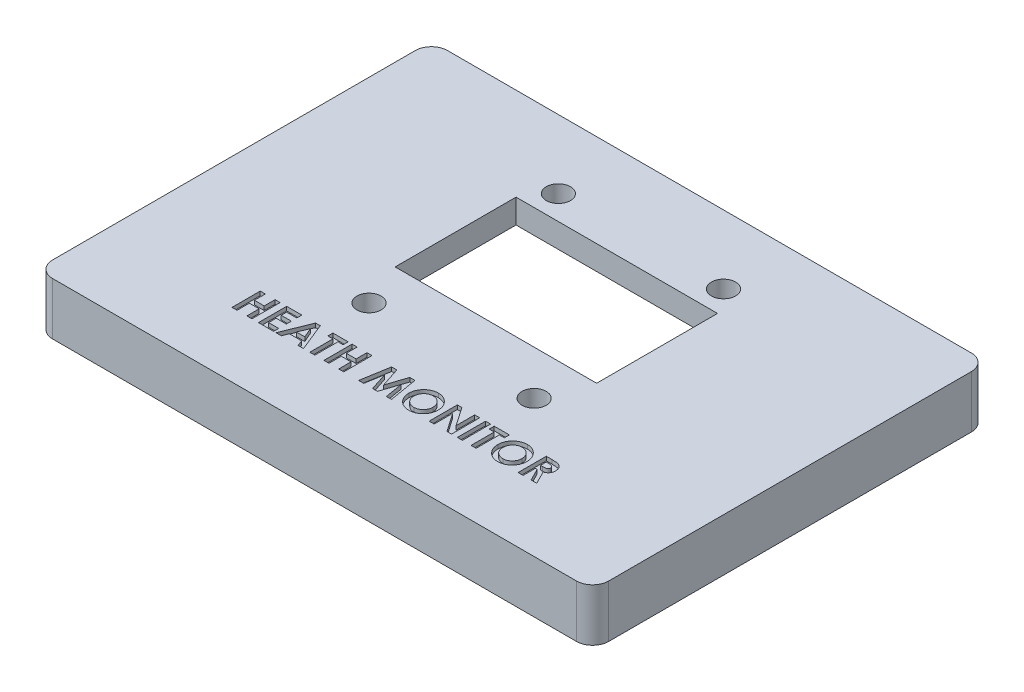
from build123d import *

# Parameters (mm, degrees)
BOSS_EXTRUDE1_DEPTH      = 3
BOSS_EXTRUDE1_DEPTH_BACK = 3.5
SKETCH2_3_W              = 25
SKETCH2_3_H              = 27.5
BOSS_EXTRUDE2_DEPTH      = 3
SKETCH3_W                = 0.628205128
SKETCH3_H                = 3.5
CUT_EXTRUDE1_DEPTH       = 0.5
BOSS_EXTRUDE5_OUTLINE_W  = 25
BOSS_EXTRUDE5_OUTLINE_H  = 27.5
BOSS_EXTRUDE5_OUTLINE_R  = 1.5
BOSS_EXTRUDE5_DEPTH      = 3
SKETCH2_11_W             = 15
SKETCH2_11_H             = 4
CUT_EXTRUDE7_DEPTH       = 2.5
CUT_EXTRUDE9_DEPTH       = 10
SKETCH2_16_W             = 10
SKETCH2_16_H             = 5
CUT_EXTRUDE10_DEPTH      = 2


# Read off the part's stored shape, not the designer's step: Boss-Extrude5
with BuildPart() as part:
    # Sketch2 → Boss-Extrude1 (new, two sides: drawn at the far end of the back side and taken through both)
    with BuildSketch(Plane(origin=(0, 0, 0), x_dir=(1, 0, 0), z_dir=(0, 1, 0)).offset(-BOSS_EXTRUDE1_DEPTH_BACK)):
        with BuildLine():
            Line((67, 49), (2, 49))
            ThreePointArc((2, 49), (0.585786438, 48.414213562), (0, 47))
            Line((0, 47), (0, 2))
            ThreePointArc((0, 2), (0.585786438, 0.585786438), (2, 0))
            Line((2, 0), (67, 0))
            ThreePointArc((67, 0), (68.414213562, 0.585786438), (69, 2))
            Line((69, 2), (69, 47))
            ThreePointArc((69, 47), (68.414213562, 48.414213562), (67, 49))
        make_face()
        with BuildLine():
            Line((6.5, 1.5), (62.5, 1.5))
            ThreePointArc((62.5, 1.5), (66.035533906, 2.964466094), (67.5, 6.5))
            Line((67.5, 6.5), (67.5, 42.5))
            ThreePointArc((67.5, 42.5), (66.035533906, 46.035533906), (62.5, 47.5))
            Line((62.5, 47.5), (6.5, 47.5))
            ThreePointArc((6.5, 47.5), (2.964466094, 46.035533906), (1.5, 42.5))
            Line((1.5, 42.5), (1.5, 6.5))
            ThreePointArc((1.5, 6.5), (2.964466094, 2.964466094), (6.5, 1.5))
        make_face(mode=Mode.SUBTRACT)
    extrude(amount=BOSS_EXTRUDE1_DEPTH + BOSS_EXTRUDE1_DEPTH_BACK)

    # Sketch2<3> → Boss-Extrude2 (add)
    with BuildSketch(Plane(origin=(0, 0, 0), x_dir=(1, 0, 0), z_dir=(0, 1, 0))):
        with BuildLine():
            Line((67.5, 6.5), (67.5, 42.5))
            ThreePointArc((67.5, 42.5), (66.035533906, 46.035533906), (62.5, 47.5))
            Line((62.5, 47.5), (6.5, 47.5))
            ThreePointArc((6.5, 47.5), (2.964466094, 46.035533906), (1.5, 42.5))
            Line((1.5, 42.5), (1.5, 6.5))
            ThreePointArc((1.5, 6.5), (2.964466094, 2.964466094), (6.5, 1.5))
            Line((6.5, 1.5), (62.5, 1.5))
            ThreePointArc((62.5, 1.5), (66.035533906, 2.964466094), (67.5, 6.5))
        make_face()
        with Locations((34.5, 28.75)):
            Rectangle(SKETCH2_3_W, SKETCH2_3_H, mode=Mode.SUBTRACT)
    extrude(amount=BOSS_EXTRUDE2_DEPTH)

    # Sketch3 → Cut-Extrude1 (cut)
    # profile 1 of 12: a face of its own
    with BuildSketch(Plane(origin=(0, 3, 0), x_dir=(1, 0, 0), z_dir=(0, 1, 0))):
        Polygon((16.228279675, 11.533237973), (16.856484804, 11.533237973), (16.856484804, 10.187084127), (18.068023265, 10.187084127), (18.068023265, 11.533237973), (18.696228393, 11.533237973), (18.696228393, 8.033237973), (18.068023265, 8.033237973), (18.068023265, 9.558878999), (16.856484804, 9.558878999), (16.856484804, 8.033237973), (16.228279675, 8.033237973), align=None)
    # profile 2 of 12: a face of its own
    with BuildSketch(Plane(origin=(0, 3, 0), x_dir=(1, 0, 0), z_dir=(0, 1, 0))):
        Polygon((19.503920701, 11.533237973), (21.388536086, 11.533237973), (21.388536086, 10.905032845), (20.132125829, 10.905032845), (20.132125829, 10.231955922), (21.388536086, 10.231955922), (21.388536086, 9.603750793), (20.132125829, 9.603750793), (20.132125829, 8.661443101), (21.388536086, 8.661443101), (21.388536086, 8.033237973), (19.503920701, 8.033237973), align=None)
    # profile 3 of 12: a face of its own
    with BuildSketch(Plane(origin=(0, 3, 0), x_dir=(1, 0, 0), z_dir=(0, 1, 0))):
        Polygon((23.094365413, 11.533237973), (23.676997624, 11.533237973), (25.090459163, 8.033237973), (24.419485605, 8.033237973), (24.147450348, 8.751186691), (22.622510445, 8.751186691), (22.350475188, 8.033237973), (21.680202752, 8.033237973), align=None)
        Polygon((23.385330957, 10.59443589), (22.860891855, 9.379391819), (23.90977006, 9.379391819), align=None, mode=Mode.SUBTRACT)
    # profile 4 of 12: a face of its own
    with BuildSketch(Plane(origin=(0, 3, 0), x_dir=(1, 0, 0), z_dir=(0, 1, 0))):
        Polygon((25.247510445, 11.533237973), (27.132125829, 11.533237973), (27.132125829, 10.905032845), (26.503920701, 10.905032845), (26.503920701, 8.033237973), (25.875715573, 8.033237973), (25.875715573, 10.905032845), (25.247510445, 10.905032845), align=None)
    # profile 5 of 12: a face of its own
    with BuildSketch(Plane(origin=(0, 3, 0), x_dir=(1, 0, 0), z_dir=(0, 1, 0))):
        Polygon((27.625715573, 11.533237973), (28.253920701, 11.533237973), (28.253920701, 10.187084127), (29.465459163, 10.187084127), (29.465459163, 11.533237973), (30.093664291, 11.533237973), (30.093664291, 8.033237973), (29.465459163, 8.033237973), (29.465459163, 9.558878999), (28.253920701, 9.558878999), (28.253920701, 8.033237973), (27.625715573, 8.033237973), align=None)
    # profile 6 of 12: a face of its own
    with BuildSketch(Plane(origin=(0, 3, 0), x_dir=(1, 0, 0), z_dir=(0, 1, 0))):
        Polygon((32.524453554, 11.533237973), (33.176496823, 11.533237973), (33.975074547, 9.091931883), (34.779261246, 11.533237973), (35.424994419, 11.533237973), (36.016741214, 8.033237973), (35.380823746, 8.033237973), (35.007125829, 10.243874992), (34.279361406, 8.033237973), (33.666580957, 8.033237973), (32.943023265, 10.243874992), (32.57002647, 8.033237973), (31.933407881, 8.033237973), align=None)
    # profile 7 of 12: a face of its own
    with BuildSketch(Plane(origin=(0, 3, 0), x_dir=(1, 0, 0), z_dir=(0, 1, 0))):
        with BuildLine():
            add(Edge.make_bspline(
                [(38.244906278, 11.622981563), (38.305758067, 11.621406001), (38.425893282, 11.618295485), (38.602568832, 11.592366908), (38.77282839, 11.550120008), (38.936594968, 11.491393762), (39.093458511, 11.414597565), (39.243972331, 11.321908638), (39.387597294, 11.211577534), (39.522861646, 11.086178096), (39.647870303, 10.949811682), (39.756190378, 10.802988994), (39.848561763, 10.649514355), (39.925119415, 10.488976524), (39.983432316, 10.320263702), (40.024352891, 10.144236099), (40.050642333, 9.960943795), (40.053666023, 9.836146719), (40.055202752, 9.772721146)],
                knots=[0, 0, 0, 0, 1.014329547, 2.002516266, 2.970391464, 3.935626869, 4.897733899, 5.877609409, 6.878433252, 7.912639331, 8.949961323, 9.958554974, 10.949718813, 11.932905612, 12.9188844, 13.919928257, 14.942845884, 16, 16, 16, 16], degree=3))
            add(Edge.make_bspline(
                [(40.055202752, 9.772721146), (40.053566202, 9.710010233), (40.050341328, 9.586436366), (40.025426141, 9.404833172), (39.983816459, 9.230691192), (39.92649259, 9.063616251), (39.851323405, 8.904417602), (39.760753362, 8.752078785), (39.65239249, 8.608013539), (39.530193135, 8.472299176), (39.395662251, 8.349109271), (39.253172688, 8.24054838), (39.103382375, 8.148557977), (38.946510557, 8.0731802), (38.78222083, 8.014682283), (38.610919011, 7.973407751), (38.432615698, 7.948324385), (38.311360799, 7.945120576), (38.249814131, 7.943494383)],
                knots=[0, 0, 0, 0, 1.051557043, 2.072126891, 3.067553643, 4.050577992, 5.02905126, 6.015227836, 7.017913613, 8.04756643, 9.074058332, 10.072836633, 11.047628519, 12.017157415, 12.98668631, 13.966869689, 14.968021931, 16, 16, 16, 16], degree=3))
            add(Edge.make_bspline(
                [(38.249814131, 7.943494383), (38.185443695, 7.944953158), (38.058964589, 7.947819451), (37.87386185, 7.97507659), (37.696517432, 8.016135364), (37.52842113, 8.077413381), (37.367861027, 8.154016054), (37.216016805, 8.248356839), (37.072939494, 8.360279831), (36.939449808, 8.486918639), (36.81850783, 8.625489271), (36.711752811, 8.771876855), (36.621702584, 8.92496312), (36.548353855, 9.084819712), (36.490528664, 9.250453162), (36.449739561, 9.422872225), (36.425644465, 9.601663378), (36.422288158, 9.723101903), (36.420587368, 9.784640217)],
                knots=[0, 0, 0, 0, 1.067978421, 2.098431617, 3.099715153, 4.085208694, 5.062210972, 6.048429807, 7.046490867, 8.072918869, 9.098532598, 10.095778865, 11.076610158, 12.041847152, 13.011192615, 13.984257998, 14.978533688, 16, 16, 16, 16], degree=3))
            add(Edge.make_bspline(
                [(36.420587368, 9.784640217), (36.421121174, 9.826039972), (36.422182026, 9.908315267), (36.434961116, 10.030243055), (36.45335933, 10.149790976), (36.480569415, 10.266482391), (36.513622715, 10.381140503), (36.556447934, 10.492698047), (36.605194622, 10.602346764), (36.662150538, 10.708791566), (36.725480009, 10.81105307), (36.794578101, 10.908648892), (36.869618559, 11.000398956), (36.950359653, 11.086906205), (37.037079628, 11.167602021), (37.128637773, 11.243628766), (37.226809782, 11.312966898), (37.329446978, 11.377309793), (37.435970716, 11.435493958), (37.545947348, 11.485018578), (37.657111138, 11.528267586), (37.770947084, 11.562401615), (37.886235232, 11.590203425), (38.004207201, 11.608589238), (38.123797183, 11.621367973), (38.204440774, 11.622442423), (38.244906278, 11.622981563)],
                knots=[0, 0, 0, 0, 1.034744296, 2.056386356, 3.06226378, 4.057406941, 5.050368692, 6.043467995, 7.042652155, 8.049140477, 9.059438543, 10.048523776, 11.036952808, 12.020949711, 13.004946614, 13.997082645, 14.994316842, 16.007702937, 17.024872941, 18.026463647, 19.021641123, 20.005082605, 20.995858141, 21.984425357, 22.988620895, 24, 24, 24, 24], degree=3))
        make_face()
        with BuildLine():
            add(Edge.make_bspline(
                [(38.235090573, 10.994776434), (38.194137327, 10.993677567), (38.113312006, 10.991508842), (37.994755981, 10.974986092), (37.880938011, 10.948597383), (37.772489032, 10.91037366), (37.668939018, 10.861724561), (37.570104407, 10.802820073), (37.477353854, 10.73163542), (37.38945062, 10.651992188), (37.310044512, 10.563251325), (37.239886712, 10.468150398), (37.181175932, 10.366848224), (37.132005287, 10.260285877), (37.094990689, 10.147265091), (37.0686263, 10.02867117), (37.051964991, 9.904299771), (37.049864812, 9.81951595), (37.048792496, 9.776226755)],
                knots=[0, 0, 0, 0, 1.033739768, 2.040188636, 3.016340934, 3.979330865, 4.937572243, 5.900995986, 6.878200029, 7.884839167, 8.891893314, 9.879764717, 10.863503415, 11.843163062, 12.837761627, 13.859916423, 14.907309254, 16, 16, 16, 16], degree=3))
            add(Edge.make_bspline(
                [(37.048792496, 9.776226755), (37.050214223, 9.728252589), (37.053000573, 9.634231171), (37.072605671, 9.497075261), (37.106148041, 9.367545117), (37.154582571, 9.246274251), (37.214654095, 9.131916041), (37.289253394, 9.025872109), (37.377172313, 8.927507515), (37.444904336, 8.870078168), (37.479281278, 8.840930281)],
                knots=[0, 0, 0, 0, 1.078454662, 2.113592447, 3.107694534, 4.079536787, 5.043276885, 6.005368276, 6.987637804, 8, 8, 8, 8], degree=3))
            add(Edge.make_bspline(
                [(37.479281278, 8.840930281), (37.507442556, 8.819396941), (37.563130635, 8.776815412), (37.652020933, 8.722238447), (37.743560436, 8.675460544), (37.838439926, 8.637664551), (37.93645902, 8.607934859), (38.037604279, 8.587115644), (38.141732387, 8.574049786), (38.212148694, 8.572488169), (38.247710765, 8.571699511)],
                knots=[0, 0, 0, 0, 1.023928204, 2.024787132, 3.009472467, 3.9914905, 4.972207045, 5.96565515, 6.972602802, 8, 8, 8, 8], degree=3))
            add(Edge.make_bspline(
                [(38.247710765, 8.571699511), (38.287959819, 8.572807696), (38.367151099, 8.574988084), (38.48350014, 8.59130743), (38.594966055, 8.618925655), (38.702240833, 8.656814066), (38.805015143, 8.706073996), (38.902786699, 8.766805517), (38.995726919, 8.838262922), (39.083518166, 8.918952044), (39.163763516, 9.008042485), (39.233774912, 9.103650671), (39.2943524, 9.203670066), (39.342500541, 9.309516295), (39.380977503, 9.420190218), (39.407024582, 9.536181985), (39.423826642, 9.657013436), (39.425927412, 9.739243508), (39.426997624, 9.781134608)],
                knots=[0, 0, 0, 0, 1.026359118, 2.019393844, 2.989460624, 3.950973911, 4.916101784, 5.890408035, 6.881132271, 7.902007068, 8.92769091, 9.933912415, 10.920395702, 11.90457117, 12.894218921, 13.903490204, 14.931958862, 16, 16, 16, 16], degree=3))
            add(Edge.make_bspline(
                [(39.426997624, 9.781134608), (39.425890383, 9.822784821), (39.423710948, 9.904766915), (39.407362879, 10.025287709), (39.379919801, 10.140767407), (39.341917615, 10.2513946), (39.293390836, 10.357277744), (39.23338255, 10.45804449), (39.16210332, 10.553597422), (39.081193633, 10.643285383), (38.99312841, 10.725702874), (38.898581595, 10.797226275), (38.800198712, 10.859377836), (38.695722379, 10.908064859), (38.587290094, 10.946853707), (38.474240196, 10.975418372), (38.356144504, 10.991392769), (38.275801563, 10.993638492), (38.235090573, 10.994776434)],
                knots=[0, 0, 0, 0, 1.055025985, 2.07665775, 3.074803781, 4.057872707, 5.035505728, 6.020516407, 7.023567878, 8.050795229, 9.077271434, 10.074415901, 11.050397877, 12.019801805, 12.988065821, 13.964604439, 14.968634123, 16, 16, 16, 16], degree=3))
        make_face(mode=Mode.SUBTRACT)
    # profile 8 of 12: a face of its own
    with BuildSketch(Plane(origin=(0, 3, 0), x_dir=(1, 0, 0), z_dir=(0, 1, 0))):
        Polygon((40.683407881, 11.533237973), (41.249213169, 11.533237973), (42.837254034, 9.230052877), (42.837254034, 11.533237973), (43.465459163, 11.533237973), (43.465459163, 8.033237973), (42.895447143, 8.033237973), (41.311613009, 10.329411851), (41.311613009, 8.033237973), (40.683407881, 8.033237973), align=None)
    # profile 9 of 12: a face of its own
    with BuildSketch(Plane(origin=(0, 3, 0), x_dir=(1, 0, 0), z_dir=(0, 1, 0))):
        with Locations((44.497510445, 9.783237973)):
            Rectangle(SKETCH3_W, SKETCH3_H)
    # profile 10 of 12: a face of its own
    with BuildSketch(Plane(origin=(0, 3, 0), x_dir=(1, 0, 0), z_dir=(0, 1, 0))):
        Polygon((45.260330957, 11.533237973), (47.144946342, 11.533237973), (47.144946342, 10.905032845), (46.516741214, 10.905032845), (46.516741214, 8.033237973), (45.888536086, 8.033237973), (45.888536086, 10.905032845), (45.260330957, 10.905032845), align=None)
    # profile 11 of 12: a face of its own
    with BuildSketch(Plane(origin=(0, 3, 0), x_dir=(1, 0, 0), z_dir=(0, 1, 0))):
        with BuildLine():
            add(Edge.make_bspline(
                [(49.283367816, 11.622981563), (49.344219606, 11.621406001), (49.464354821, 11.618295485), (49.64103037, 11.592366908), (49.811289929, 11.550120008), (49.975056506, 11.491393762), (50.13192005, 11.414597565), (50.28243387, 11.321908638), (50.426058833, 11.211577534), (50.561323185, 11.086178096), (50.686331842, 10.949811682), (50.794651916, 10.802988994), (50.887023302, 10.649514355), (50.963580953, 10.488976524), (51.021893855, 10.320263702), (51.062814429, 10.144236099), (51.089103871, 9.960943795), (51.092127562, 9.836146719), (51.093664291, 9.772721146)],
                knots=[0, 0, 0, 0, 1.014329547, 2.002516266, 2.970391464, 3.935626869, 4.897733899, 5.877609409, 6.878433252, 7.912639331, 8.949961323, 9.958554974, 10.949718813, 11.932905612, 12.9188844, 13.919928257, 14.942845884, 16, 16, 16, 16], degree=3))
            add(Edge.make_bspline(
                [(51.093664291, 9.772721146), (51.092027741, 9.710010233), (51.088802867, 9.586436366), (51.06388768, 9.404833172), (51.022277997, 9.230691192), (50.964954128, 9.063616251), (50.889784943, 8.904417602), (50.7992149, 8.752078785), (50.690854028, 8.608013539), (50.568654674, 8.472299176), (50.434123789, 8.349109271), (50.291634226, 8.24054838), (50.141843913, 8.148557977), (49.984972095, 8.0731802), (49.820682369, 8.014682283), (49.649380549, 7.973407751), (49.471077237, 7.948324385), (49.349822337, 7.945120576), (49.288275669, 7.943494383)],
                knots=[0, 0, 0, 0, 1.051557043, 2.072126891, 3.067553643, 4.050577992, 5.02905126, 6.015227836, 7.017913613, 8.04756643, 9.074058332, 10.072836633, 11.047628519, 12.017157415, 12.98668631, 13.966869689, 14.968021931, 16, 16, 16, 16], degree=3))
            add(Edge.make_bspline(
                [(49.288275669, 7.943494383), (49.223905234, 7.944953158), (49.097426127, 7.947819451), (48.912323388, 7.97507659), (48.73497897, 8.016135364), (48.566882668, 8.077413381), (48.406322565, 8.154016054), (48.254478343, 8.248356839), (48.111401032, 8.360279831), (47.977911346, 8.486918639), (47.856969368, 8.625489271), (47.750214349, 8.771876855), (47.660164123, 8.92496312), (47.586815394, 9.084819712), (47.528990202, 9.250453162), (47.4882011, 9.422872225), (47.464106003, 9.601663378), (47.460749696, 9.723101903), (47.459048906, 9.784640217)],
                knots=[0, 0, 0, 0, 1.067978421, 2.098431617, 3.099715153, 4.085208694, 5.062210972, 6.048429807, 7.046490867, 8.072918869, 9.098532598, 10.095778865, 11.076610158, 12.041847152, 13.011192615, 13.984257998, 14.978533688, 16, 16, 16, 16], degree=3))
            add(Edge.make_bspline(
                [(47.459048906, 9.784640217), (47.459582712, 9.826039972), (47.460643565, 9.908315267), (47.473422654, 10.030243055), (47.491820868, 10.149790976), (47.519030954, 10.266482391), (47.552084254, 10.381140503), (47.594909472, 10.492698047), (47.643656161, 10.602346764), (47.700612077, 10.708791566), (47.763941548, 10.81105307), (47.833039639, 10.908648892), (47.908080097, 11.000398956), (47.988821191, 11.086906205), (48.075541167, 11.167602021), (48.167099312, 11.243628766), (48.26527132, 11.312966898), (48.367908516, 11.377309793), (48.474432254, 11.435493958), (48.584408886, 11.485018578), (48.695572676, 11.528267586), (48.809408622, 11.562401615), (48.92469677, 11.590203425), (49.04266874, 11.608589238), (49.162258722, 11.621367973), (49.242902313, 11.622442423), (49.283367816, 11.622981563)],
                knots=[0, 0, 0, 0, 1.034744296, 2.056386356, 3.06226378, 4.057406941, 5.050368692, 6.043467995, 7.042652155, 8.049140477, 9.059438543, 10.048523776, 11.036952808, 12.020949711, 13.004946614, 13.997082645, 14.994316842, 16.007702937, 17.024872941, 18.026463647, 19.021641123, 20.005082605, 20.995858141, 21.984425357, 22.988620895, 24, 24, 24, 24], degree=3))
        make_face()
        with BuildLine():
            add(Edge.make_bspline(
                [(49.273552111, 10.994776434), (49.232598865, 10.993677567), (49.151773545, 10.991508842), (49.03321752, 10.974986092), (48.919399549, 10.948597383), (48.81095057, 10.91037366), (48.707400557, 10.861724561), (48.608565946, 10.802820073), (48.515815393, 10.73163542), (48.427912158, 10.651992188), (48.348506051, 10.563251325), (48.27834825, 10.468150398), (48.219637471, 10.366848224), (48.170466825, 10.260285877), (48.133452227, 10.147265091), (48.107087839, 10.02867117), (48.090426529, 9.904299771), (48.08832635, 9.81951595), (48.087254034, 9.776226755)],
                knots=[0, 0, 0, 0, 1.033739768, 2.040188636, 3.016340934, 3.979330865, 4.937572243, 5.900995986, 6.878200029, 7.884839167, 8.891893314, 9.879764717, 10.863503415, 11.843163062, 12.837761627, 13.859916423, 14.907309254, 16, 16, 16, 16], degree=3))
            add(Edge.make_bspline(
                [(48.087254034, 9.776226755), (48.088675762, 9.728252589), (48.091462112, 9.634231171), (48.111067209, 9.497075261), (48.144609579, 9.367545117), (48.193044109, 9.246274251), (48.253115634, 9.131916041), (48.327714933, 9.025872109), (48.415633852, 8.927507515), (48.483365874, 8.870078168), (48.517742816, 8.840930281)],
                knots=[0, 0, 0, 0, 1.078454662, 2.113592447, 3.107694534, 4.079536787, 5.043276885, 6.005368276, 6.987637804, 8, 8, 8, 8], degree=3))
            add(Edge.make_bspline(
                [(48.517742816, 8.840930281), (48.545904095, 8.819396941), (48.601592174, 8.776815412), (48.690482471, 8.722238447), (48.782021975, 8.675460544), (48.876901464, 8.637664551), (48.974920559, 8.607934859), (49.076065817, 8.587115644), (49.180193926, 8.574049786), (49.250610232, 8.572488169), (49.286172304, 8.571699511)],
                knots=[0, 0, 0, 0, 1.023928204, 2.024787132, 3.009472467, 3.9914905, 4.972207045, 5.96565515, 6.972602802, 8, 8, 8, 8], degree=3))
            add(Edge.make_bspline(
                [(49.286172304, 8.571699511), (49.326421358, 8.572807696), (49.405612638, 8.574988084), (49.521961678, 8.59130743), (49.633427593, 8.618925655), (49.740702372, 8.656814066), (49.843476682, 8.706073996), (49.941248237, 8.766805517), (50.034188458, 8.838262922), (50.121979705, 8.918952044), (50.202225054, 9.008042485), (50.27223645, 9.103650671), (50.332813939, 9.203670066), (50.38096208, 9.309516295), (50.419439041, 9.420190218), (50.445486121, 9.536181985), (50.46228818, 9.657013436), (50.464388951, 9.739243508), (50.465459163, 9.781134608)],
                knots=[0, 0, 0, 0, 1.026359118, 2.019393844, 2.989460624, 3.950973911, 4.916101784, 5.890408035, 6.881132271, 7.902007068, 8.92769091, 9.933912415, 10.920395702, 11.90457117, 12.894218921, 13.903490204, 14.931958862, 16, 16, 16, 16], degree=3))
            add(Edge.make_bspline(
                [(50.465459163, 9.781134608), (50.464351921, 9.822784821), (50.462172486, 9.904766915), (50.445824417, 10.025287709), (50.41838134, 10.140767407), (50.380379154, 10.2513946), (50.331852374, 10.357277744), (50.271844089, 10.45804449), (50.200564859, 10.553597422), (50.119655171, 10.643285383), (50.031589949, 10.725702874), (49.937043133, 10.797226275), (49.838660251, 10.859377836), (49.734183918, 10.908064859), (49.625751632, 10.946853707), (49.512701735, 10.975418372), (49.394606043, 10.991392769), (49.314263101, 10.993638492), (49.273552111, 10.994776434)],
                knots=[0, 0, 0, 0, 1.055025985, 2.07665775, 3.074803781, 4.057872707, 5.035505728, 6.020516407, 7.023567878, 8.050795229, 9.077271434, 10.074415901, 11.050397877, 12.019801805, 12.988065821, 13.964604439, 14.968634123, 16, 16, 16, 16], degree=3))
        make_face(mode=Mode.SUBTRACT)
    # profile 12 of 12: a face of its own
    with BuildSketch(Plane(origin=(0, 3, 0), x_dir=(1, 0, 0), z_dir=(0, 1, 0))):
        with BuildLine():
            Line((51.721869419, 11.533237973), (52.453840573, 11.533237973))
            add(Edge.make_bspline(
                [(52.453840573, 11.533237973), (52.502223643, 11.533066241), (52.595277917, 11.532735952), (52.729457096, 11.527524862), (52.852719125, 11.520273203), (52.965246504, 11.509206979), (53.066991092, 11.494534503), (53.158054862, 11.477238082), (53.23843515, 11.457525103), (53.308809854, 11.432961175), (53.372319545, 11.405253436), (53.431519406, 11.373416737), (53.487715474, 11.337805588), (53.540532141, 11.297482964), (53.590428394, 11.253174259), (53.637498366, 11.204834872), (53.681076914, 11.152054905), (53.7208942, 11.09516786), (53.75718445, 11.035323993), (53.78925742, 10.972441138), (53.815339213, 10.906475565), (53.838385272, 10.838380618), (53.854984602, 10.767182867), (53.866529194, 10.693575434), (53.874981692, 10.617299213), (53.87546767, 10.565480535), (53.875715573, 10.539047268)],
                knots=[0, 0, 0, 0, 1.749336639, 3.364467119, 4.854658419, 6.213483162, 7.451590619, 8.570285859, 9.5643256, 10.440900261, 11.26203566, 12.067320669, 12.869050712, 13.665104639, 14.467235401, 15.27997916, 16.102287765, 16.939272006, 17.78853747, 18.631303466, 19.488103222, 20.351255419, 21.228522269, 22.127379805, 23.044756219, 24, 24, 24, 24], degree=3))
            add(Edge.make_bspline(
                [(53.875715573, 10.539047268), (53.875071611, 10.511457009), (53.873808918, 10.457357541), (53.86700737, 10.377889834), (53.854576275, 10.30186069), (53.835747575, 10.229492714), (53.814106429, 10.159885202), (53.785329257, 10.094322455), (53.752851373, 10.031850959), (53.71427834, 9.973354397), (53.671946321, 9.917533442), (53.622715072, 9.866526804), (53.569774024, 9.817593067), (53.510147167, 9.773797276), (53.446462908, 9.732178118), (53.377455907, 9.694460076), (53.303576529, 9.659695008), (53.251635667, 9.640307604), (53.225074547, 9.630393422)],
                knots=[0, 0, 0, 0, 1.099860209, 2.156625411, 3.176576793, 4.16617041, 5.135385252, 6.078461593, 7.016046972, 7.938469504, 8.868247731, 9.803980173, 10.76021508, 11.73834243, 12.748633912, 13.790971185, 14.870363756, 16, 16, 16, 16], degree=3))
            Line((53.225074547, 9.630393422), (54.032766855, 8.033237973))
            Line((54.032766855, 8.033237973), (53.334449547, 8.033237973))
            Line((53.334449547, 8.033237973), (52.563215573, 9.558878999))
            Line((52.563215573, 9.558878999), (52.350074547, 9.558878999))
            Line((52.350074547, 9.558878999), (52.350074547, 8.033237973))
            Line((52.350074547, 8.033237973), (51.721869419, 8.033237973))
            Line((51.721869419, 8.033237973), (51.721869419, 11.533237973))
        make_face()
        with BuildLine():
            Line((52.350074547, 10.187084127), (52.594766054, 10.187084127))
            add(Edge.make_bspline(
                [(52.594766054, 10.187084127), (52.624681624, 10.187421056), (52.681963514, 10.188066203), (52.764342395, 10.191058663), (52.839162065, 10.198269013), (52.906743826, 10.20737902), (52.967427741, 10.217897839), (53.020672534, 10.232971945), (53.067298623, 10.249124231), (53.106753489, 10.269197333), (53.14046282, 10.292024804), (53.16956867, 10.317957378), (53.193643381, 10.347971031), (53.213458096, 10.38125012), (53.22887179, 10.418088992), (53.240122606, 10.458083238), (53.246410148, 10.501688445), (53.247133551, 10.531781975), (53.247510445, 10.547460729)],
                knots=[0, 0, 0, 0, 1.688639943, 3.233382647, 4.650958383, 5.928841754, 7.082724185, 8.122798841, 9.049171256, 9.863274652, 10.613301712, 11.341792392, 12.054588806, 12.776240173, 13.521029143, 14.301969904, 15.115324896, 16, 16, 16, 16], degree=3))
            add(Edge.make_bspline(
                [(53.247510445, 10.547460729), (53.246797893, 10.56600984), (53.245398216, 10.602446132), (53.231509079, 10.654901616), (53.209400572, 10.703452755), (53.179095865, 10.747880183), (53.140931026, 10.786828333), (53.097133862, 10.821161438), (53.046759125, 10.848309489), (53.000115909, 10.866216054), (52.957681485, 10.876929736), (52.919385756, 10.884913478), (52.875039072, 10.890571785), (52.824607952, 10.896573426), (52.768220948, 10.900465187), (52.705570717, 10.903305396), (52.636837189, 10.904467466), (52.588923392, 10.904838959), (52.563916695, 10.905032845)],
                knots=[0, 0, 0, 0, 1.020303359, 2.004196876, 2.966617323, 3.9489082, 4.950758222, 5.960522915, 7.003732012, 8.091992268, 8.70421221, 9.413913587, 10.24622431, 11.166358409, 12.212345909, 13.359657661, 14.621978493, 16, 16, 16, 16], degree=3))
            Line((52.563916695, 10.905032845), (52.350074547, 10.905032845))
            Line((52.350074547, 10.905032845), (52.350074547, 10.187084127))
        make_face(mode=Mode.SUBTRACT)
    extrude(amount=-CUT_EXTRUDE1_DEPTH, mode=Mode.SUBTRACT)

    # Boss-Extrude5 outline → Boss-Extrude5 (add)
    with BuildSketch(Plane(origin=(0, 0, 0), x_dir=(1, 0, 0), z_dir=(0, 1, 0))):
        with Locations((34.5, 28.75)):
            Rectangle(BOSS_EXTRUDE5_OUTLINE_W, BOSS_EXTRUDE5_OUTLINE_H)
        with Locations((24.255424551, 17)):
            Circle(BOSS_EXTRUDE5_OUTLINE_R, mode=Mode.SUBTRACT)
        with Locations((44.744575449, 17)):
            Circle(BOSS_EXTRUDE5_OUTLINE_R, mode=Mode.SUBTRACT)
        with Locations((24.255424551, 40.5)):
            Circle(BOSS_EXTRUDE5_OUTLINE_R, mode=Mode.SUBTRACT)
        with Locations((44.744575449, 40.5)):
            Circle(BOSS_EXTRUDE5_OUTLINE_R, mode=Mode.SUBTRACT)
    extrude(amount=BOSS_EXTRUDE5_DEPTH)

    # Sketch2<11> → Cut-Extrude7 (cut)
    with BuildSketch(Plane(origin=(0, 0, 0), x_dir=(1, 0, 0), z_dir=(0, 1, 0))):
        with Locations((33.828968348, 40.5)):
            Rectangle(SKETCH2_11_W, SKETCH2_11_H)
    extrude(amount=CUT_EXTRUDE7_DEPTH, mode=Mode.SUBTRACT)

    # Sketch2<14> → Cut-Extrude9 (cut)
    with BuildSketch(Plane(origin=(0, 0, 0), x_dir=(1, 0, 0), z_dir=(0, 1, 0))):
        Polygon((47, 37.5), (22, 37.5), (22, 22.5), (29.5, 22.5), (34.5, 22.5), (39.5, 22.5), (47, 22.5), align=None)
    extrude(amount=CUT_EXTRUDE9_DEPTH, mode=Mode.SUBTRACT)

    # Sketch2<16> → Cut-Extrude10 (cut)
    with BuildSketch(Plane(origin=(0, 0, 0), x_dir=(1, 0, 0), z_dir=(0, 1, 0))):
        with Locations((34.5, 17.5)):
            Rectangle(SKETCH2_16_W, SKETCH2_16_H)
    extrude(amount=CUT_EXTRUDE10_DEPTH, mode=Mode.SUBTRACT)


solid = part.part
